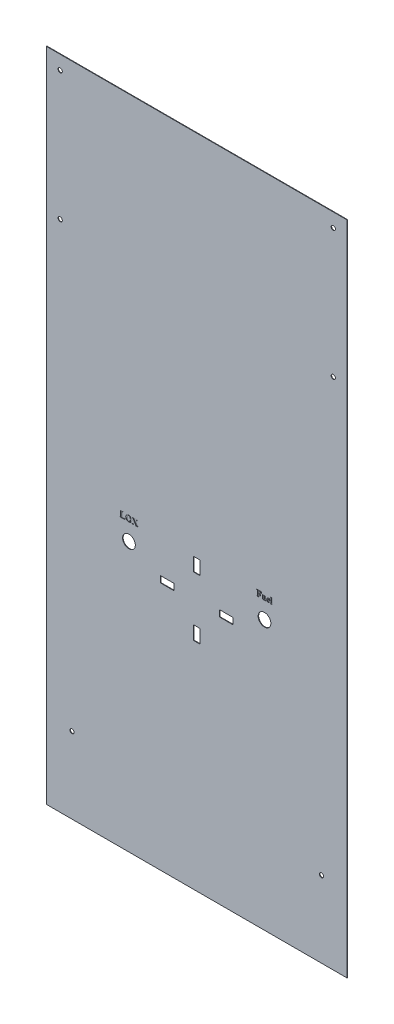
from build123d import *

# Parameters (mm, degrees)
SKETCH1_W           = 901.7
SKETCH1_H           = 1968.5
SKETCH1_R           = 6.35
BOSS_EXTRUDE1_DEPTH = 1.5875
SKETCH2_R           = 19.05
SKETCH2_W           = 19.05
SKETCH2_H           = 40.64
SKETCH2_W_2         = 40.64
SKETCH2_H_2         = 19.05
CUT_EXTRUDE1_DEPTH  = 1083.597018819
WRAP1_START         = -3.81
WRAP1_DEPTH         = 1.27


# Read off the part's stored shape, not the designer's step: Wrap1
with BuildPart() as part:
    # Sketch1 → Boss-Extrude1 (new body)
    with BuildSketch(Plane.XY):
        Rectangle(SKETCH1_W, SKETCH1_H)
        with Locations((-409.447415534, 942.65240495)):
            Circle(SKETCH1_R, mode=Mode.SUBTRACT)
        with Locations((-409.447415534, 555.94759505)):
            Circle(SKETCH1_R, mode=Mode.SUBTRACT)
        with Locations((-374.018387972, -755.65)):
            Circle(SKETCH1_R, mode=Mode.SUBTRACT)
        with Locations(Location((374.018387972, -755.65, 0), (0, 0, 180))):
            Circle(SKETCH1_R, mode=Mode.SUBTRACT)
        with Locations(Location((409.447415534, 555.94759505, 0), (0, 0, 180))):
            Circle(SKETCH1_R, mode=Mode.SUBTRACT)
        with Locations(Location((409.447415534, 942.65240495, 0), (0, 0, 180))):
            Circle(SKETCH1_R, mode=Mode.SUBTRACT)
    extrude(amount=BOSS_EXTRUDE1_DEPTH)

    # Sketch2 → Cut-Extrude1 (cut, through all)
    with BuildSketch(Plane(origin=(0, 0, 0), x_dir=(-1, 0, 0), z_dir=(0, 0, -1))):
        with Locations((203.2, -177.8)):
            Circle(SKETCH2_R)
        with Locations(Location((-203.2, -177.8, 0), (0, 0, 180))):
            Circle(SKETCH2_R)
        with Locations((0, -139.7)):
            Rectangle(SKETCH2_W, SKETCH2_H)
        with Locations((-88.9, -228.6)):
            Rectangle(SKETCH2_W_2, SKETCH2_H_2)
        with Locations((88.9, -228.6)):
            Rectangle(SKETCH2_W_2, SKETCH2_H_2)
        with Locations((0, -317.5)):
            Rectangle(SKETCH2_W, SKETCH2_H)
    extrude(amount=-CUT_EXTRUDE1_DEPTH, mode=Mode.SUBTRACT)

    # Wrap1 outline → Wrap1 (cut)
    # profile 1 of 7: a face of its own
    with BuildSketch(Plane.XY.offset(4.1275).offset(WRAP1_START)):
        with BuildLine():
            add(Edge.make_bspline(
                [(-229.753426043, -126.522165256), (-229.636237529, -126.519976219), (-229.41317649, -126.515809523), (-229.09617467, -126.466288885), (-228.813209456, -126.387863271), (-228.646163395, -126.304456099), (-228.566305351, -126.264582464)],
                knots=[0, 0, 0, 0, 0.286116983, 0.54460586, 0.782294265, 1, 1, 1, 1], degree=3))
            Line((-229.753426043, -126.522165256), (-230.317121718, -126.522165256))
            Line((-230.317121718, -126.522165256), (-230.317121718, -127))
            Line((-230.317121718, -127), (-215.265327284, -127))
            Line((-215.265327284, -127), (-214.548575168, -120.788148329))
            Line((-214.548575168, -120.788148329), (-215.026409912, -120.788148329))
            add(Edge.make_bspline(
                [(-220.151934157, -125.80541314), (-219.932562836, -125.800281899), (-219.510508502, -125.790409766), (-218.907320259, -125.698872442), (-218.358302074, -125.557162613), (-217.864370172, -125.344330626), (-217.414474169, -125.065851051), (-217.002301016, -124.717785385), (-216.620132883, -124.304052356), (-216.331879217, -123.906660058), (-216.11791995, -123.547865792), (-215.951997015, -123.245314942), (-215.794334863, -122.908249637), (-215.632393068, -122.54506771), (-215.481375396, -122.148092083), (-215.322503972, -121.724083219), (-215.171391707, -121.266497406), (-215.07550252, -120.950123175), (-215.026409912, -120.788148329)],
                knots=[0, 0, 0, 0, 0.083692486, 0.161018205, 0.232346257, 0.299586786, 0.365500353, 0.433621102, 0.504882686, 0.580041871, 0.620531465, 0.664319798, 0.71170201, 0.762539634, 0.816086004, 0.873798358, 0.935388254, 1, 1, 1, 1], degree=3))
            Line((-220.151934157, -125.80541314), (-221.585438389, -125.80541314))
            add(Edge.make_bspline(
                [(-223.119735887, -125.693420622), (-223.047852608, -125.711296101), (-222.870193417, -125.755475265), (-222.540067551, -125.779019781), (-222.101040503, -125.803347996), (-221.769696871, -125.804675129), (-221.585438389, -125.80541314)],
                knots=[0, 0, 0, 0, 0.143896066, 0.355638461, 0.641673878, 1, 1, 1, 1], degree=3))
            add(Edge.make_bspline(
                [(-223.866352675, -123.498367267), (-223.865392, -123.601652345), (-223.863551432, -123.799537588), (-223.856493191, -124.080826647), (-223.844815466, -124.333432834), (-223.832218453, -124.555332016), (-223.808811963, -124.748212218), (-223.783249281, -124.91138468), (-223.756011668, -125.047332218), (-223.70606115, -125.185917292), (-223.625445227, -125.332812904), (-223.491822327, -125.481418383), (-223.318626353, -125.601331533), (-223.187975318, -125.661824804), (-223.119735887, -125.693420622)],
                knots=[0, 0, 0, 0, 0.124219593, 0.237993955, 0.338360787, 0.42835088, 0.505199409, 0.571874059, 0.627062731, 0.671557261, 0.748594982, 0.82701569, 0.909649771, 1, 1, 1, 1], degree=3))
            Line((-223.866352675, -123.498367267), (-223.866352675, -112.664957682))
            add(Edge.make_bspline(
                [(-223.739427821, -111.119460932), (-223.749999809, -111.149146381), (-223.773852692, -111.216123714), (-223.798505966, -111.335239557), (-223.821268807, -111.483376173), (-223.833059635, -111.663254918), (-223.849289377, -111.87085995), (-223.861102616, -112.108602576), (-223.862236444, -112.376276017), (-223.864933293, -112.565412846), (-223.866352675, -112.664957682)],
                knots=[0, 0, 0, 0, 0.06067886, 0.136905735, 0.233920776, 0.349449884, 0.48411048, 0.635389887, 0.808101606, 1, 1, 1, 1], degree=3))
            add(Edge.make_bspline(
                [(-223.261593077, -110.533366754), (-223.310259198, -110.565232512), (-223.409867386, -110.630454278), (-223.538040862, -110.765996793), (-223.649286752, -110.930935983), (-223.708665918, -111.055124151), (-223.739427821, -111.119460932)],
                knots=[0, 0, 0, 0, 0.226387342, 0.463362038, 0.721989949, 1, 1, 1, 1], degree=3))
            add(Edge.make_bspline(
                [(-222.160333316, -110.275783963), (-222.268802824, -110.278119635), (-222.476986966, -110.28260246), (-222.772042924, -110.330870623), (-223.035001757, -110.410815629), (-223.188015126, -110.493572376), (-223.261593077, -110.533366754)],
                knots=[0, 0, 0, 0, 0.284002636, 0.54508263, 0.781248603, 1, 1, 1, 1], degree=3))
            Line((-222.160333316, -110.275783963), (-221.477178955, -110.275783963))
            Line((-221.477178955, -110.275783963), (-221.477178955, -109.797949219))
            Line((-221.477178955, -109.797949219), (-230.317121718, -109.797949219))
            Line((-230.317121718, -109.797949219), (-230.317121718, -110.275783963))
            Line((-230.317121718, -110.275783963), (-229.753426043, -110.275783963))
            add(Edge.make_bspline(
                [(-227.927947998, -112.664957682), (-227.929376487, -112.564168786), (-227.932110034, -112.371299754), (-227.933119221, -112.09740266), (-227.945249249, -111.853456485), (-227.960174603, -111.640682081), (-227.976466296, -111.455801376), (-228.004528872, -111.302130434), (-228.026816696, -111.175687487), (-228.073793401, -111.049072991), (-228.148610431, -110.910709437), (-228.275397871, -110.764872143), (-228.434574129, -110.630147904), (-228.626451322, -110.505917808), (-228.855303867, -110.400345023), (-229.122678716, -110.328270983), (-229.42585248, -110.282806886), (-229.64000416, -110.27821564), (-229.753426043, -110.275783963)],
                knots=[0, 0, 0, 0, 0.084622749, 0.161933587, 0.22990784, 0.289599081, 0.34105252, 0.385532842, 0.420773186, 0.448530112, 0.498553263, 0.551922288, 0.609709232, 0.67316662, 0.743282504, 0.820338844, 0.90484545, 1, 1, 1, 1], degree=3))
            Line((-227.927947998, -112.664957682), (-227.927947998, -124.132991536))
            add(Edge.make_bspline(
                [(-228.066072104, -125.678488286), (-228.053878904, -125.648919223), (-228.026103286, -125.581562086), (-228.005452117, -125.460770969), (-227.975507496, -125.313738641), (-227.960396653, -125.134824087), (-227.945152957, -124.925847451), (-227.933270797, -124.688097364), (-227.932024686, -124.420430161), (-227.929359829, -124.232536736), (-227.927947998, -124.132991536)],
                knots=[0, 0, 0, 0, 0.061394352, 0.139853863, 0.234760276, 0.350352995, 0.484827155, 0.638289672, 0.808367287, 1, 1, 1, 1], degree=3))
            add(Edge.make_bspline(
                [(-228.566305351, -126.264582464), (-228.513841635, -126.232933684), (-228.407719614, -126.168915485), (-228.271425976, -126.033307564), (-228.155927585, -125.868003182), (-228.096632758, -125.742944001), (-228.066072104, -125.678488286)],
                knots=[0, 0, 0, 0, 0.23335888, 0.472031298, 0.72788403, 1, 1, 1, 1], degree=3))
        make_face()
    # profile 2 of 7: a face of its own
    with BuildSketch(Plane.XY.offset(4.1275).offset(WRAP1_START)):
        with BuildLine():
            add(Edge.make_bspline(
                [(-194.718433295, -118.260850504), (-194.724017479, -118.527395433), (-194.735035576, -119.053312496), (-194.827203283, -119.829949656), (-194.977372559, -120.582130209), (-195.180608052, -121.312966858), (-195.451068619, -122.017123582), (-195.783231756, -122.69419378), (-196.164460973, -123.35329381), (-196.468850095, -123.762458061), (-196.622306103, -123.968735843)],
                knots=[0, 0, 0, 0, 0.130405832, 0.257302407, 0.382101033, 0.505478704, 0.628069418, 0.750625341, 0.874279213, 1, 1, 1, 1], degree=3))
            add(Edge.make_bspline(
                [(-203.909285948, -109.559031847), (-203.576856146, -109.553848597), (-202.926775912, -109.543712539), (-201.973128758, -109.637324107), (-201.066575694, -109.807149904), (-200.206609472, -110.059482945), (-199.398043873, -110.403407626), (-198.634697098, -110.827047087), (-197.919622082, -111.336565182), (-197.261501448, -111.926383685), (-196.66864867, -112.576115942), (-196.145231314, -113.269846968), (-195.70250353, -114.003776103), (-195.342394477, -114.778877827), (-195.06002235, -115.592766401), (-194.864971074, -116.447883307), (-194.741519452, -117.341405333), (-194.726223502, -117.950592369), (-194.718433295, -118.260850504)],
                knots=[0, 0, 0, 0, 0.069849949, 0.136594465, 0.20103729, 0.263531056, 0.324607527, 0.385387455, 0.446727247, 0.508796852, 0.570828957, 0.631365177, 0.691215795, 0.75067175, 0.810735822, 0.87197288, 0.934795961, 1, 1, 1, 1], degree=3))
            add(Edge.make_bspline(
                [(-212.876153564, -118.272049756), (-212.868157043, -117.961837627), (-212.852455997, -117.352740923), (-212.731856278, -116.457996138), (-212.525783502, -115.604326355), (-212.240446011, -114.788989394), (-211.87789791, -114.011937584), (-211.430577993, -113.276279528), (-210.899609784, -112.582201243), (-210.294740021, -111.934406847), (-209.633428736, -111.3455359), (-208.927659924, -110.831424373), (-208.1808215, -110.409611212), (-207.398487794, -110.06609697), (-206.578639267, -109.807869114), (-205.720070019, -109.63766039), (-204.82597401, -109.543972597), (-204.218086037, -109.553958913), (-203.909285948, -109.559031847)],
                knots=[0, 0, 0, 0, 0.066265956, 0.130112177, 0.192469093, 0.253598737, 0.314376421, 0.375339326, 0.437182314, 0.500765603, 0.564420002, 0.626110784, 0.686953563, 0.747315202, 0.808362113, 0.870201672, 0.934063944, 1, 1, 1, 1], degree=3))
            add(Edge.make_bspline(
                [(-210.882686742, -124.121792285), (-211.041964948, -123.914138898), (-211.358752432, -123.501138302), (-211.765029578, -122.838579483), (-212.106515122, -122.146758921), (-212.387202635, -121.427235156), (-212.608287484, -120.679395853), (-212.764464604, -119.902462731), (-212.860479239, -119.097003096), (-212.870876009, -118.549812049), (-212.876153564, -118.272049756)],
                knots=[0, 0, 0, 0, 0.124469297, 0.247556251, 0.369105337, 0.491161059, 0.614633392, 0.73970266, 0.867869208, 1, 1, 1, 1], degree=3))
            add(Edge.make_bspline(
                [(-203.745030255, -127.238917372), (-203.934245051, -127.237184516), (-204.308079424, -127.233760888), (-204.860990224, -127.193963899), (-205.39821356, -127.136256498), (-205.919316031, -127.05062999), (-206.422649041, -126.9359105), (-206.913431242, -126.809580948), (-207.38332404, -126.64672569), (-207.83756508, -126.462373568), (-208.278052534, -126.25912154), (-208.700899992, -126.027151484), (-209.104515854, -125.767855886), (-209.493225434, -125.487366165), (-209.868142157, -125.18574585), (-210.223166586, -124.854873643), (-210.563395068, -124.500787124), (-210.775787893, -124.248679752), (-210.882686742, -124.121792285)],
                knots=[0, 0, 0, 0, 0.070311969, 0.138916362, 0.205924571, 0.271084613, 0.335043637, 0.397754782, 0.459328336, 0.519703925, 0.579914551, 0.639525377, 0.698797951, 0.758099388, 0.817616847, 0.877506899, 0.938348334, 1, 1, 1, 1], degree=3))
            add(Edge.make_bspline(
                [(-196.622306103, -123.968735843), (-196.728949032, -124.102023109), (-196.940164733, -124.366010264), (-197.283101614, -124.734937967), (-197.635197756, -125.084869872), (-198.011845907, -125.40091671), (-198.399119001, -125.697042327), (-198.803860249, -125.967274303), (-199.225970337, -126.209236136), (-199.663398873, -126.426575744), (-200.117876159, -126.616624885), (-200.586542788, -126.786275217), (-201.075280584, -126.922569372), (-201.578199328, -127.039072591), (-202.097972362, -127.128677976), (-202.632721999, -127.190039728), (-203.183066067, -127.234871185), (-203.555792531, -127.237554845), (-203.745030255, -127.238917372)],
                knots=[0, 0, 0, 0, 0.062892078, 0.124563294, 0.185534769, 0.245726785, 0.305624548, 0.365154215, 0.424941259, 0.484831998, 0.54505371, 0.606415486, 0.668404777, 0.731930775, 0.796623147, 0.862668568, 0.930275174, 1, 1, 1, 1], degree=3))
        make_face()
        with BuildLine():
            add(Edge.make_bspline(
                [(-207.336257002, -112.877743467), (-207.418011601, -113.046803464), (-207.587222221, -113.396713404), (-207.782425416, -113.966883133), (-207.955597854, -114.586083402), (-208.096394776, -115.258230894), (-208.202657758, -115.983986359), (-208.279731821, -116.761310103), (-208.329848235, -117.590726366), (-208.334386685, -118.161225378), (-208.336723497, -118.454970868)],
                knots=[0, 0, 0, 0, 0.098492955, 0.203854633, 0.315738249, 0.435901004, 0.564024753, 0.700575662, 0.845828744, 1, 1, 1, 1], degree=3))
            add(Edge.make_bspline(
                [(-203.759962591, -110.514701335), (-203.950981852, -110.521329236), (-204.32403358, -110.534273219), (-204.864161608, -110.651635695), (-205.370511851, -110.832833113), (-205.839443614, -111.097103002), (-206.275888465, -111.429981496), (-206.669491416, -111.845337128), (-207.030434857, -112.329324537), (-207.232117168, -112.690993562), (-207.336257002, -112.877743467)],
                knots=[0, 0, 0, 0, 0.126292685, 0.246643735, 0.364165419, 0.481050344, 0.601480292, 0.726142767, 0.858592225, 1, 1, 1, 1], degree=3))
            add(Edge.make_bspline(
                [(-199.257863363, -118.555764135), (-199.260150236, -118.28570862), (-199.264577899, -117.762848584), (-199.294598316, -117.004720651), (-199.342354753, -116.298778745), (-199.408046938, -115.644744856), (-199.495249504, -115.0437181), (-199.610124055, -114.49664799), (-199.731670696, -113.999601347), (-199.883973099, -113.55448585), (-200.051568333, -113.153189474), (-200.220491672, -112.780337458), (-200.40937288, -112.442418253), (-200.600277353, -112.129008589), (-200.81201909, -111.85395378), (-201.027892107, -111.603286144), (-201.259982249, -111.387840569), (-201.578216058, -111.139023945), (-202.003960149, -110.884710985), (-202.557457648, -110.672459309), (-203.145997012, -110.53477257), (-203.552612772, -110.521479837), (-203.759962591, -110.514701335)],
                knots=[0, 0, 0, 0, 0.078235768, 0.15147388, 0.219769184, 0.283189358, 0.341871029, 0.39560353, 0.44509179, 0.490008293, 0.531715711, 0.571069594, 0.608500784, 0.643809453, 0.677264075, 0.708938794, 0.739545141, 0.768823346, 0.825888193, 0.882390021, 0.940025916, 1, 1, 1, 1], degree=3))
            add(Edge.make_bspline(
                [(-201.609706243, -125.659822867), (-201.518910442, -125.590370406), (-201.334389107, -125.449224443), (-201.075831196, -125.206206225), (-200.838968032, -124.92773117), (-200.61305054, -124.624253287), (-200.404645933, -124.290370142), (-200.209378265, -123.928329827), (-200.036400501, -123.533280409), (-199.869397069, -123.111498101), (-199.726283579, -122.655643678), (-199.596770806, -122.168011215), (-199.496883696, -121.645799464), (-199.404119426, -121.092516696), (-199.339843069, -120.505377496), (-199.289895411, -119.885502452), (-199.266084208, -119.231633965), (-199.260648465, -118.784738968), (-199.257863363, -118.555764135)],
                knots=[0, 0, 0, 0, 0.044242423, 0.089912429, 0.137048047, 0.185612229, 0.236272384, 0.289296534, 0.344719967, 0.403142498, 0.464849718, 0.529587621, 0.598372434, 0.670607157, 0.746741958, 0.826962138, 0.911340884, 1, 1, 1, 1], degree=3))
            add(Edge.make_bspline(
                [(-203.786094178, -126.283247884), (-203.577534203, -126.277488771), (-203.174112894, -126.266348815), (-202.597987697, -126.140658338), (-202.068139274, -125.953526382), (-201.760935203, -125.756710469), (-201.609706243, -125.659822867)],
                knots=[0, 0, 0, 0, 0.271629072, 0.525416998, 0.766374536, 1, 1, 1, 1], degree=3))
            add(Edge.make_bspline(
                [(-206.794959831, -124.838544401), (-206.703104717, -124.954220234), (-206.52357018, -125.180313328), (-206.21090486, -125.474389772), (-205.875288692, -125.728431585), (-205.505384156, -125.927398468), (-205.115500528, -126.09224697), (-204.695677531, -126.202467996), (-204.250044979, -126.271235548), (-203.943147012, -126.279181566), (-203.786094178, -126.283247884)],
                knots=[0, 0, 0, 0, 0.12750736, 0.249218294, 0.369884192, 0.490218952, 0.611248533, 0.734906211, 0.864340154, 1, 1, 1, 1], degree=3))
            add(Edge.make_bspline(
                [(-208.336723497, -118.454970868), (-208.333476883, -118.803555521), (-208.327195784, -119.477948657), (-208.249358748, -120.453508534), (-208.133703357, -121.359168115), (-207.967016958, -122.194241479), (-207.751395889, -122.960169556), (-207.48801407, -123.655909283), (-207.176706047, -124.284764584), (-206.920066783, -124.657058109), (-206.794959831, -124.838544401)],
                knots=[0, 0, 0, 0, 0.156670188, 0.303103704, 0.439658844, 0.566921389, 0.685563365, 0.796936138, 0.901010077, 1, 1, 1, 1], degree=3))
        make_face(mode=Mode.SUBTRACT)
    # profile 3 of 7: a face of its own
    with BuildSketch(Plane.XY.offset(4.1275).offset(WRAP1_START)):
        with BuildLine():
            add(Edge.make_bspline(
                [(-178.315262477, -123.901540332), (-178.220954099, -124.042332192), (-178.040973638, -124.311022891), (-177.780417607, -124.691101697), (-177.542567801, -125.028886613), (-177.321117656, -125.319631326), (-177.124841845, -125.569878388), (-176.950043375, -125.777286062), (-176.794414717, -125.938631232), (-176.614360473, -126.095060742), (-176.388000485, -126.240639613), (-176.102705495, -126.377493649), (-175.792360898, -126.470692124), (-175.576923504, -126.504766569), (-175.466919433, -126.522165256)],
                knots=[0, 0, 0, 0, 0.126497608, 0.241411193, 0.343994715, 0.434841881, 0.514196246, 0.581398797, 0.637233328, 0.681363404, 0.759169511, 0.837285515, 0.916916671, 1, 1, 1, 1], degree=3))
            Line((-178.315262477, -123.901540332), (-182.847226376, -117.058797476))
            Line((-182.847226376, -117.058797476), (-179.67410503, -113.116660839))
            add(Edge.make_bspline(
                [(-178.035281181, -111.138126352), (-178.067911162, -111.171467294), (-178.144929118, -111.250163361), (-178.270668934, -111.394301992), (-178.43270684, -111.576080202), (-178.621005906, -111.804397521), (-178.841537657, -112.072940804), (-179.091408658, -112.383005643), (-179.372355461, -112.735384894), (-179.569662217, -112.984692027), (-179.67410503, -113.116660839)],
                knots=[0, 0, 0, 0, 0.054447391, 0.128514533, 0.223210912, 0.338706703, 0.473921181, 0.62886415, 0.803542095, 1, 1, 1, 1], degree=3))
            add(Edge.make_bspline(
                [(-175.870092498, -110.275783963), (-175.988388839, -110.28054247), (-176.213111938, -110.289582027), (-176.53193173, -110.325021943), (-176.814061909, -110.385280788), (-177.069543497, -110.463935091), (-177.309766105, -110.576399345), (-177.5452197, -110.730779986), (-177.792284414, -110.916455595), (-177.951864525, -111.062030552), (-178.035281181, -111.138126352)],
                knots=[0, 0, 0, 0, 0.147897503, 0.280955311, 0.400178886, 0.507855505, 0.614267687, 0.73028563, 0.859013314, 1, 1, 1, 1], degree=3))
            Line((-175.870092498, -110.275783963), (-175.870092498, -109.797949219))
            Line((-175.870092498, -109.797949219), (-182.283530702, -109.797949219))
            Line((-182.283530702, -109.797949219), (-182.283530702, -110.275783963))
            add(Edge.make_bspline(
                [(-180.394590229, -111.526367082), (-180.403774393, -111.415123672), (-180.422240277, -111.191455202), (-180.57988662, -110.882221614), (-180.818105816, -110.61362874), (-181.096798512, -110.451322452), (-181.369936212, -110.360529529), (-181.630665232, -110.309534589), (-181.94074642, -110.282292916), (-182.16401731, -110.278053341), (-182.283530702, -110.275783963)],
                knots=[0, 0, 0, 0, 0.130173209, 0.261729146, 0.399541564, 0.547861549, 0.634397953, 0.737427191, 0.859448911, 1, 1, 1, 1], degree=3))
            add(Edge.make_bspline(
                [(-181.77956437, -113.919273885), (-181.670165064, -113.783270081), (-181.462006767, -113.524490375), (-181.183403562, -113.142693233), (-180.942598204, -112.797280643), (-180.746913136, -112.482078866), (-180.592210352, -112.200149806), (-180.481139557, -111.948754979), (-180.412179484, -111.727798585), (-180.400053988, -111.588937844), (-180.394590229, -111.526367082)],
                knots=[0, 0, 0, 0, 0.187080214, 0.355964768, 0.50655841, 0.638342089, 0.753533152, 0.850920003, 0.932824433, 1, 1, 1, 1], degree=3))
            Line((-181.77956437, -113.919273885), (-183.504249149, -116.062064065))
            Line((-183.504249149, -116.062064065), (-185.609708489, -112.885209635))
            Line((-185.609708489, -112.885209635), (-186.479517047, -111.574897173))
            add(Edge.make_bspline(
                [(-186.565377977, -111.093329345), (-186.562378123, -111.181261317), (-186.556756568, -111.34604082), (-186.504082454, -111.502111254), (-186.479517047, -111.574897173)],
                knots=[0, 0, 0, 0, 0.533634166, 1, 1, 1, 1], degree=3))
            add(Edge.make_bspline(
                [(-185.258798599, -110.275783963), (-185.37104042, -110.27798624), (-185.579143812, -110.282069401), (-185.863294114, -110.327280866), (-186.098857514, -110.391690812), (-186.275812465, -110.500759486), (-186.407129066, -110.626867808), (-186.500166643, -110.768269442), (-186.554446759, -110.926544536), (-186.561681095, -111.036923576), (-186.565377977, -111.093329345)],
                knots=[0, 0, 0, 0, 0.193798871, 0.359315288, 0.49675642, 0.612601935, 0.714528736, 0.809401167, 0.902600404, 1, 1, 1, 1], degree=3))
            Line((-185.258798599, -110.275783963), (-184.829493946, -110.275783963))
            Line((-184.829493946, -110.275783963), (-184.829493946, -109.797949219))
            Line((-184.829493946, -109.797949219), (-193.221466637, -109.797949219))
            Line((-193.221466637, -109.797949219), (-193.221466637, -110.275783963))
            add(Edge.make_bspline(
                [(-191.646105215, -111.134393268), (-191.700723502, -111.068399346), (-191.804776639, -110.94267452), (-191.976203892, -110.781825301), (-192.140999932, -110.645457869), (-192.314779915, -110.541253063), (-192.499368964, -110.450303007), (-192.714520602, -110.384128408), (-192.956368151, -110.317695745), (-193.130245394, -110.290205942), (-193.221466637, -110.275783963)],
                knots=[0, 0, 0, 0, 0.138951375, 0.264715855, 0.381158651, 0.485468856, 0.593016643, 0.714420306, 0.850176286, 1, 1, 1, 1], degree=3))
            add(Edge.make_bspline(
                [(-190.425386768, -112.892675802), (-190.510008736, -112.76824351), (-190.66916105, -112.53421814), (-190.893644324, -112.203950584), (-191.090125143, -111.919755069), (-191.2558718, -111.677666631), (-191.393563225, -111.479483765), (-191.504256651, -111.326045529), (-191.583346182, -111.213936229), (-191.628526414, -111.156673246), (-191.646105215, -111.134393268)],
                knots=[0, 0, 0, 0, 0.210884309, 0.396619539, 0.559630646, 0.695069056, 0.807787606, 0.897795021, 0.960233914, 1, 1, 1, 1], degree=3))
            Line((-190.425386768, -112.892675802), (-186.15100566, -119.347177929))
            Line((-186.15100566, -119.347177929), (-189.484649616, -123.487168015))
            add(Edge.make_bspline(
                [(-191.84022558, -125.913672574), (-191.766050175, -125.859885825), (-191.606062475, -125.743874079), (-191.366058271, -125.535878004), (-191.099990605, -125.294138782), (-190.816694507, -125.0094193), (-190.515967961, -124.681894349), (-190.185947113, -124.322032296), (-189.840526286, -123.918365216), (-189.606143705, -123.634376066), (-189.484649616, -123.487168015)],
                knots=[0, 0, 0, 0, 0.081036263, 0.17478577, 0.280771193, 0.39911038, 0.529989712, 0.674191297, 0.831114449, 1, 1, 1, 1], degree=3))
            add(Edge.make_bspline(
                [(-193.605974282, -126.522165256), (-193.428475542, -126.492064393), (-193.090058547, -126.434674445), (-192.617066321, -126.297633403), (-192.196800775, -126.137494655), (-191.955258099, -125.985878432), (-191.84022558, -125.913672574)],
                knots=[0, 0, 0, 0, 0.286640828, 0.546506005, 0.784027577, 1, 1, 1, 1], degree=3))
            Line((-193.605974282, -126.522165256), (-193.605974282, -127))
            Line((-193.605974282, -127), (-186.901355531, -127))
            Line((-186.901355531, -127), (-186.901355531, -126.522165256))
            add(Edge.make_bspline(
                [(-187.983949873, -126.451236661), (-187.92808433, -126.462106428), (-187.794865981, -126.488026741), (-187.557390939, -126.506108324), (-187.252494845, -126.5219491), (-187.025831792, -126.52208863), (-186.901355531, -126.522165256)],
                knots=[0, 0, 0, 0, 0.157013586, 0.374418457, 0.65645018, 1, 1, 1, 1], degree=3))
            add(Edge.make_bspline(
                [(-189.182269817, -125.357443068), (-189.178851806, -125.416422899), (-189.172072093, -125.53341092), (-189.110462365, -125.705148863), (-189.013051414, -125.867543086), (-188.879299513, -126.022595825), (-188.710655866, -126.166853091), (-188.499640293, -126.282553785), (-188.255487944, -126.382385117), (-188.078006956, -126.427387426), (-187.983949873, -126.451236661)],
                knots=[0, 0, 0, 0, 0.100751351, 0.199842915, 0.30878505, 0.423694858, 0.549243335, 0.686728538, 0.833979966, 1, 1, 1, 1], degree=3))
            add(Edge.make_bspline(
                [(-188.010081461, -123.468502596), (-188.103204143, -123.578415982), (-188.279522639, -123.786526001), (-188.514294387, -124.09516081), (-188.716886225, -124.372651741), (-188.880348063, -124.624214005), (-189.016057474, -124.842408939), (-189.104691846, -125.038941749), (-189.167747871, -125.205610863), (-189.177829475, -125.311017685), (-189.182269817, -125.357443068)],
                knots=[0, 0, 0, 0, 0.192150646, 0.363818055, 0.517241748, 0.650310056, 0.764194402, 0.859271298, 0.938017447, 1, 1, 1, 1], degree=3))
            Line((-188.010081461, -123.468502596), (-185.493982887, -120.340178257))
            Line((-185.493982887, -120.340178257), (-183.175737762, -123.841810989))
            add(Edge.make_bspline(
                [(-182.294729953, -125.256649801), (-182.333521799, -125.178930532), (-182.426187099, -124.993276065), (-182.619758612, -124.684435407), (-182.871831428, -124.288855042), (-183.067842083, -124.000524766), (-183.175737762, -123.841810989)],
                knots=[0, 0, 0, 0, 0.156153027, 0.373015693, 0.654871322, 1, 1, 1, 1], degree=3))
            add(Edge.make_bspline(
                [(-182.208869023, -125.663555951), (-182.212308373, -125.590514532), (-182.218918647, -125.450132254), (-182.270153016, -125.319374036), (-182.294729953, -125.256649801)],
                knots=[0, 0, 0, 0, 0.520303695, 1, 1, 1, 1], degree=3))
            add(Edge.make_bspline(
                [(-183.78049736, -126.522165256), (-183.62973452, -126.507746945), (-183.3557518, -126.481544413), (-182.988379234, -126.422634598), (-182.706918014, -126.34236816), (-182.505315768, -126.234799413), (-182.371657244, -126.106352373), (-182.274562777, -125.9723012), (-182.220308703, -125.820433904), (-182.212708266, -125.716205383), (-182.208869023, -125.663555951)],
                knots=[0, 0, 0, 0, 0.22952437, 0.417116787, 0.563269803, 0.671351673, 0.759411843, 0.842075566, 0.920226904, 1, 1, 1, 1], degree=3))
            Line((-183.78049736, -126.522165256), (-183.78049736, -127))
            Line((-183.78049736, -127), (-175.466919433, -127))
            Line((-175.466919433, -127), (-175.466919433, -126.522165256))
        make_face()
    # profile 4 of 7: a face of its own
    with BuildSketch(Plane.XY.offset(4.1275).offset(WRAP1_START)):
        with BuildLine():
            add(Edge.make_bspline(
                [(225.897150336, -124.371908908), (225.89779293, -124.478935376), (225.899018732, -124.683097566), (225.910148184, -124.974412762), (225.928150444, -125.235967251), (225.953767852, -125.466429096), (225.985672624, -125.667875825), (226.030754716, -125.836986712), (226.077542972, -125.978284731), (226.152056385, -126.125592134), (226.286821706, -126.274708238), (226.505716323, -126.402368284), (226.780484112, -126.485826486), (226.982878765, -126.509456044), (227.091737196, -126.522165256)],
                knots=[0, 0, 0, 0, 0.113303814, 0.216136768, 0.308589519, 0.390787078, 0.461608663, 0.524237009, 0.575901825, 0.618914388, 0.6982322, 0.78453931, 0.884113971, 1, 1, 1, 1], degree=3))
            Line((225.897150336, -124.371908908), (225.897150336, -109.797949219))
            Line((225.897150336, -109.797949219), (221.118802897, -109.797949219))
            Line((221.118802897, -109.797949219), (221.118802897, -110.275783963))
            add(Edge.make_bspline(
                [(222.313389757, -112.42604031), (222.312711865, -112.319019474), (222.311418729, -112.114868025), (222.300788763, -111.824721152), (222.281474139, -111.564634085), (222.258992353, -111.33456812), (222.218104833, -111.135078672), (222.18235245, -110.963141627), (222.128237881, -110.824214327), (222.055408195, -110.675778042), (221.91875454, -110.527441679), (221.703421231, -110.395520993), (221.428802406, -110.3118181), (221.227634815, -110.288434512), (221.118802897, -110.275783963)],
                knots=[0, 0, 0, 0, 0.113475465, 0.216464207, 0.307741029, 0.390063115, 0.461224767, 0.523628009, 0.575823302, 0.618901027, 0.698339003, 0.785468901, 0.883938407, 1, 1, 1, 1], degree=3))
            Line((222.313389757, -112.42604031), (222.313389757, -124.371908908))
            add(Edge.make_bspline(
                [(222.100603973, -126.03313126), (222.117659052, -126.002426672), (222.156537167, -125.93243365), (222.199031444, -125.803696314), (222.235040733, -125.643622125), (222.264353755, -125.451474495), (222.286208578, -125.227171483), (222.299234716, -124.970542076), (222.311920293, -124.681873132), (222.31288234, -124.478941952), (222.313389757, -124.371908908)],
                knots=[0, 0, 0, 0, 0.062274042, 0.141957556, 0.239524505, 0.353613935, 0.486876676, 0.639624286, 0.809925169, 1, 1, 1, 1], degree=3))
            add(Edge.make_bspline(
                [(221.118802897, -126.522165256), (221.222937791, -126.512967248), (221.420694176, -126.495499859), (221.694726847, -126.399501839), (221.929352913, -126.247804202), (222.043116973, -126.105194483), (222.100603973, -126.03313126)],
                knots=[0, 0, 0, 0, 0.274716901, 0.521698533, 0.75830578, 1, 1, 1, 1], degree=3))
            Line((221.118802897, -126.522165256), (221.118802897, -127))
            Line((221.118802897, -127), (227.091737196, -127))
            Line((227.091737196, -127), (227.091737196, -126.522165256))
        make_face()
    # profile 5 of 7: a face of its own
    with BuildSketch(Plane.XY.offset(4.1275).offset(WRAP1_START)):
        with BuildLine():
            add(Edge.make_bspline(
                [(213.473446994, -120.788148329), (213.484435832, -120.960148917), (213.505943609, -121.29679511), (213.583114555, -121.786676721), (213.684978238, -122.249040656), (213.821703415, -122.682893581), (213.983799397, -123.090003948), (214.180318154, -123.468878969), (214.401634918, -123.824018593), (214.579570657, -124.035377647), (214.668033854, -124.140457704)],
                knots=[0, 0, 0, 0, 0.142498601, 0.278903765, 0.409754711, 0.533792625, 0.654786412, 0.771718901, 0.886506916, 1, 1, 1, 1], degree=3))
            Line((213.473446994, -120.788148329), (219.685298665, -120.788148329))
            add(Edge.make_bspline(
                [(215.186932521, -115.054131402), (215.332744169, -115.058510463), (215.622200037, -115.067203493), (216.048806762, -115.134412784), (216.458018259, -115.253112742), (216.855015559, -115.409736193), (217.234216931, -115.616447449), (217.601105015, -115.865873655), (217.951321342, -116.161091595), (218.283547274, -116.50245011), (218.594544826, -116.883472124), (218.86336233, -117.315423435), (219.099552053, -117.785633618), (219.293677172, -118.302842174), (219.448696858, -118.86284987), (219.567373822, -119.466872314), (219.649949143, -120.112981811), (219.673298611, -120.558950461), (219.685298665, -120.788148329)],
                knots=[0, 0, 0, 0, 0.053851778, 0.106903072, 0.158993774, 0.210976872, 0.264244788, 0.318174982, 0.374616845, 0.433126587, 0.493931417, 0.555909881, 0.620664302, 0.688022464, 0.759624451, 0.835078572, 0.915241487, 1, 1, 1, 1], degree=3))
            add(Edge.make_bspline(
                [(209.889686415, -121.336911668), (209.894719185, -121.10276357), (209.90454369, -120.645681529), (209.980594115, -119.978999285), (210.102613191, -119.349353239), (210.2741664, -118.754968824), (210.497535894, -118.198065108), (210.772958134, -117.678469985), (211.094379424, -117.194692575), (211.463511022, -116.751469289), (211.868601015, -116.356868909), (212.289861517, -116.006538666), (212.730381362, -115.712693562), (213.188089446, -115.471799928), (213.664038535, -115.28490749), (214.156563033, -115.148604378), (214.666675717, -115.069113443), (215.012450108, -115.059156041), (215.186932521, -115.054131402)],
                knots=[0, 0, 0, 0, 0.076562623, 0.149458401, 0.21913521, 0.286105541, 0.351475226, 0.415010164, 0.478105644, 0.541102612, 0.603263254, 0.662822278, 0.720048412, 0.77611527, 0.831661283, 0.886950275, 0.942953587, 1, 1, 1, 1], degree=3))
            add(Edge.make_bspline(
                [(210.968547673, -125.271582137), (210.88102663, -125.137625359), (210.705153318, -124.868439554), (210.492613936, -124.431055744), (210.303414385, -123.974618269), (210.150153402, -123.492736846), (210.037104595, -122.986250765), (209.948583271, -122.458223958), (209.902174638, -121.905168811), (209.893899387, -121.528616399), (209.889686415, -121.336911668)],
                knots=[0, 0, 0, 0, 0.115803047, 0.23270593, 0.351552617, 0.473563527, 0.598418097, 0.72719374, 0.861112958, 1, 1, 1, 1], degree=3))
            add(Edge.make_bspline(
                [(214.914417394, -127.238917372), (214.703729756, -127.233864665), (214.292610381, -127.224005208), (213.696785522, -127.127513253), (213.13887858, -126.977069211), (212.622985722, -126.757196627), (212.145015008, -126.480466919), (211.707965539, -126.139364108), (211.30691038, -125.738898373), (211.082697561, -125.429235729), (210.968547673, -125.271582137)],
                knots=[0, 0, 0, 0, 0.137204424, 0.267729979, 0.392271254, 0.512917972, 0.632116942, 0.751180664, 0.873322589, 1, 1, 1, 1], degree=3))
            add(Edge.make_bspline(
                [(219.685298665, -123.416239421), (219.605780294, -123.584895446), (219.451712401, -123.911668717), (219.204794229, -124.376907407), (218.950341491, -124.801946302), (218.694303997, -125.193874332), (218.424581023, -125.543359165), (218.15255458, -125.859695507), (217.873300421, -126.136028928), (217.586567255, -126.375587228), (217.288999838, -126.576118976), (216.984868778, -126.755089568), (216.667742744, -126.902249872), (216.340858213, -127.028855322), (216.000030954, -127.120331824), (215.648204292, -127.18765311), (215.285001608, -127.229779755), (215.038965215, -127.235846355), (214.914417394, -127.238917372)],
                knots=[0, 0, 0, 0, 0.085828138, 0.166293149, 0.242330062, 0.313823047, 0.381648941, 0.445397375, 0.505750891, 0.562298265, 0.617113102, 0.670757122, 0.724569091, 0.777869471, 0.831927831, 0.886751647, 0.942671751, 1, 1, 1, 1], degree=3))
            Line((219.685298665, -123.416239421), (219.255994013, -123.177322049))
            add(Edge.make_bspline(
                [(216.672699928, -125.088661024), (216.791421251, -125.083974405), (217.025324331, -125.074740892), (217.365670203, -124.991010226), (217.691516567, -124.865737813), (218.002764023, -124.673953047), (218.310747805, -124.415701638), (218.624350768, -124.079404838), (218.942669548, -123.658350097), (219.14729079, -123.344207513), (219.255994013, -123.177322049)],
                knots=[0, 0, 0, 0, 0.105424729, 0.207706318, 0.31005375, 0.414825833, 0.531164543, 0.666607217, 0.822888038, 1, 1, 1, 1], degree=3))
            add(Edge.make_bspline(
                [(214.668033854, -124.140457704), (214.737224099, -124.216910611), (214.87225015, -124.36610988), (215.100832508, -124.556095409), (215.334102487, -124.723587943), (215.583593361, -124.852302243), (215.839535799, -124.960699447), (216.10831747, -125.033406274), (216.387327271, -125.080545548), (216.576688627, -125.085930639), (216.672699928, -125.088661024)],
                knots=[0, 0, 0, 0, 0.134919963, 0.263298817, 0.388576173, 0.510368139, 0.630257589, 0.752082285, 0.87429905, 1, 1, 1, 1], degree=3))
        make_face()
        with BuildLine():
            add(Edge.make_bspline(
                [(215.758094364, -116.21885359), (215.715890545, -116.185464945), (215.631040376, -116.118337554), (215.474479544, -116.057257161), (215.302645961, -116.013317442), (215.179795928, -116.011002805), (215.116003927, -116.00980089)],
                knots=[0, 0, 0, 0, 0.232672174, 0.467784049, 0.723637675, 1, 1, 1, 1], degree=3))
            add(Edge.make_bspline(
                [(216.57937283, -119.832478841), (216.57815544, -119.683164175), (216.575821963, -119.396959862), (216.572034655, -118.984794933), (216.54875463, -118.609325407), (216.535561247, -118.270170354), (216.502716886, -117.96930557), (216.470920622, -117.703778395), (216.432081819, -117.47387069), (216.367082665, -117.223662081), (216.275295191, -116.951215735), (216.135391836, -116.663950962), (215.965533996, -116.416189083), (215.826465873, -116.283894804), (215.758094364, -116.21885359)],
                knots=[0, 0, 0, 0, 0.117461895, 0.225149355, 0.32413075, 0.413337278, 0.492033041, 0.562085029, 0.623719301, 0.675235114, 0.765312701, 0.849359813, 0.925939196, 1, 1, 1, 1], degree=3))
            Line((216.57937283, -119.832478841), (213.473446994, -119.832478841))
            Line((213.473446994, -119.832478841), (213.473446994, -119.425572692))
            add(Edge.make_bspline(
                [(214.145402103, -116.599628152), (214.091434461, -116.688287968), (213.980986667, -116.869735237), (213.844736112, -117.165381535), (213.728537195, -117.483751515), (213.636225129, -117.826357975), (213.561311693, -118.19146538), (213.509581338, -118.581886146), (213.480528455, -118.995820581), (213.475846785, -119.279936775), (213.473446994, -119.425572692)],
                knots=[0, 0, 0, 0, 0.105683126, 0.216286423, 0.330999153, 0.450650361, 0.577463014, 0.710511166, 0.851610106, 1, 1, 1, 1], degree=3))
            add(Edge.make_bspline(
                [(215.116003927, -116.00980089), (215.020260492, -116.016772573), (214.83218273, -116.030467701), (214.565365604, -116.148259392), (214.329499766, -116.339846718), (214.208686654, -116.510326903), (214.145402103, -116.599628152)],
                knots=[0, 0, 0, 0, 0.241168632, 0.473750048, 0.724338765, 1, 1, 1, 1], degree=3))
        make_face(mode=Mode.SUBTRACT)
    # profile 6 of 7: a face of its own
    with BuildSketch(Plane.XY.offset(4.1275).offset(WRAP1_START)):
        with BuildLine():
            add(Edge.make_bspline(
                [(206.783760579, -124.371908908), (206.784395331, -124.481422313), (206.785600291, -124.689313397), (206.796716774, -124.98562686), (206.814858649, -125.249598645), (206.839487333, -125.481578661), (206.874699328, -125.680382411), (206.908140845, -125.849243391), (206.956107465, -125.984974566), (207.031210314, -126.124276012), (207.170474694, -126.25992339), (207.387587762, -126.383262682), (207.662881164, -126.474804773), (207.868148551, -126.505621261), (207.978347439, -126.522165256)],
                knots=[0, 0, 0, 0, 0.116020453, 0.220243522, 0.314076703, 0.396332412, 0.467204098, 0.527976068, 0.578435535, 0.619154622, 0.694668533, 0.780359926, 0.882085058, 1, 1, 1, 1], degree=3))
            Line((206.783760579, -124.371908908), (206.783760579, -115.293048774))
            Line((206.783760579, -115.293048774), (202.00541314, -115.293048774))
            Line((202.00541314, -115.293048774), (202.00541314, -115.770883518))
            add(Edge.make_bspline(
                [(203.2, -117.921139865), (203.199305079, -117.81163153), (203.197985899, -117.603750069), (203.187677488, -117.308613101), (203.167253485, -117.046210669), (203.148921221, -116.816286749), (203.113921953, -116.618234257), (203.074152161, -116.453668371), (203.031530681, -116.31754321), (202.956042568, -116.181060606), (202.820065788, -116.043443893), (202.60464931, -115.916301083), (202.325177344, -115.826497773), (202.117978104, -115.790461121), (202.00541314, -115.770883518)],
                knots=[0, 0, 0, 0, 0.116169972, 0.220527356, 0.313164742, 0.395388824, 0.465050798, 0.526201019, 0.575042058, 0.615813621, 0.690509018, 0.77698849, 0.878844718, 1, 1, 1, 1], degree=3))
            Line((203.2, -117.921139865), (203.2, -124.237517887))
            add(Edge.make_bspline(
                [(202.091274071, -125.566495768), (202.174168154, -125.500185334), (202.359746653, -125.351733352), (202.618448108, -125.051194896), (202.912171947, -124.679578898), (203.099173586, -124.392372239), (203.2, -124.237517887)],
                knots=[0, 0, 0, 0, 0.182785657, 0.409210003, 0.681461416, 1, 1, 1, 1], degree=3))
            add(Edge.make_bspline(
                [(201.337191115, -125.80541314), (201.405906056, -125.802690298), (201.541119666, -125.797332435), (201.737527339, -125.750398248), (201.923789255, -125.676431443), (202.035123548, -125.603352516), (202.091274071, -125.566495768)],
                knots=[0, 0, 0, 0, 0.256146427, 0.504031335, 0.749862335, 1, 1, 1, 1], degree=3))
            add(Edge.make_bspline(
                [(200.332991536, -123.416239421), (200.334563848, -123.609112963), (200.33740506, -123.957641112), (200.353207655, -124.423695093), (200.383795475, -124.777918677), (200.428600591, -125.03642746), (200.501057154, -125.224236772), (200.575624313, -125.379730475), (200.676959184, -125.506762863), (200.817296813, -125.652791125), (201.041677323, -125.776861321), (201.238560088, -125.795883652), (201.337191115, -125.80541314)],
                knots=[0, 0, 0, 0, 0.199348445, 0.360228488, 0.481666427, 0.566912627, 0.629979681, 0.689220041, 0.744263756, 0.797005927, 0.898307431, 1, 1, 1, 1], degree=3))
            Line((200.332991536, -123.416239421), (200.332991536, -115.293048774))
            Line((200.332991536, -115.293048774), (195.554644097, -115.293048774))
            Line((195.554644097, -115.293048774), (195.554644097, -115.770883518))
            add(Edge.make_bspline(
                [(196.749230957, -117.921139865), (196.748536036, -117.81163153), (196.747216856, -117.603750069), (196.736908445, -117.308613101), (196.716484442, -117.046210669), (196.698152178, -116.816286749), (196.66315291, -116.618234257), (196.623383118, -116.453668371), (196.580761638, -116.31754321), (196.505273525, -116.181060606), (196.369296745, -116.043443893), (196.153880267, -115.916301083), (195.874408301, -115.826497773), (195.667209061, -115.790461121), (195.554644097, -115.770883518)],
                knots=[0, 0, 0, 0, 0.116169972, 0.220527356, 0.313164742, 0.395388824, 0.465050798, 0.526201019, 0.575042058, 0.615813621, 0.690509018, 0.77698849, 0.878844718, 1, 1, 1, 1], degree=3))
            Line((196.749230957, -117.921139865), (196.749230957, -122.468036101))
            add(Edge.make_bspline(
                [(199.731965023, -127.238917372), (199.574450382, -127.232085326), (199.263998307, -127.218619767), (198.814905916, -127.101348143), (198.390881884, -126.916256375), (198.006341292, -126.655549568), (197.666138045, -126.347710182), (197.377250195, -126.010835987), (197.15593907, -125.644107303), (197.016184065, -125.315925275), (196.937954288, -125.024561219), (196.886111458, -124.769069793), (196.847860462, -124.474366357), (196.808296033, -124.144937171), (196.785905934, -123.777205499), (196.760707047, -123.374239053), (196.75161589, -122.933464828), (196.750047115, -122.627312512), (196.749230957, -122.468036101)],
                knots=[0, 0, 0, 0, 0.073706266, 0.145270708, 0.216025163, 0.289613689, 0.36186854, 0.430559966, 0.496765889, 0.561852933, 0.59693819, 0.637994494, 0.683929235, 0.73615498, 0.793447977, 0.856523856, 0.925356223, 1, 1, 1, 1], degree=3))
            add(Edge.make_bspline(
                [(203.2, -125.424638579), (203.06595107, -125.582794182), (202.810615825, -125.884047611), (202.399047994, -126.276474217), (201.990476897, -126.598034205), (201.571338387, -126.842790192), (201.140440278, -127.019702058), (200.692647179, -127.148548154), (200.219779811, -127.223449933), (199.896481662, -127.233700943), (199.731965023, -127.238917372)],
                knots=[0, 0, 0, 0, 0.152850907, 0.29114909, 0.418761231, 0.535586322, 0.647932721, 0.761543386, 0.878656649, 1, 1, 1, 1], degree=3))
            Line((203.2, -125.424638579), (203.2, -127))
            Line((203.2, -127), (207.978347439, -127))
            Line((207.978347439, -127), (207.978347439, -126.522165256))
        make_face()
    # profile 7 of 7: a face of its own
    with BuildSketch(Plane.XY.offset(4.1275).offset(WRAP1_START)):
        with BuildLine():
            add(Edge.make_bspline(
                [(186.475783963, -117.682222493), (186.650254704, -117.678657999), (186.983378702, -117.671852165), (187.458634767, -117.600656413), (187.883080829, -117.482524367), (188.264204856, -117.316630361), (188.605632982, -117.088620321), (188.915513057, -116.799955045), (189.193835836, -116.443673836), (189.449285584, -116.02720192), (189.670166659, -115.536315637), (189.847791253, -114.967537753), (189.979776588, -114.320544081), (190.032113919, -113.861314768), (190.059544542, -113.62062717)],
                knots=[0, 0, 0, 0, 0.085711886, 0.163653148, 0.23548944, 0.301755796, 0.367069612, 0.436320393, 0.5090161, 0.588638511, 0.675961237, 0.772877052, 0.880962136, 1, 1, 1, 1], degree=3))
            Line((186.475783963, -117.682222493), (185.997949219, -117.682222493))
            Line((185.997949219, -117.682222493), (185.997949219, -110.992536079))
            Line((185.997949219, -110.992536079), (187.670370822, -110.992536079))
            add(Edge.make_bspline(
                [(190.43658602, -111.186656443), (190.368281418, -111.171058377), (190.218790583, -111.136920589), (189.972068262, -111.096888096), (189.685530122, -111.064061546), (189.359165129, -111.039453606), (188.993377978, -111.016141724), (188.587566261, -111.001990915), (188.142005799, -110.995475393), (187.832139682, -110.993544251), (187.670370822, -110.992536079)],
                knots=[0, 0, 0, 0, 0.075634617, 0.16553324, 0.269692222, 0.386960346, 0.518876508, 0.665423944, 0.825331057, 1, 1, 1, 1], degree=3))
            add(Edge.make_bspline(
                [(193.40438775, -115.054131402), (193.388669256, -114.909552949), (193.358198612, -114.629284456), (193.286034461, -114.225855791), (193.200287, -113.850786298), (193.101337579, -113.503124264), (192.982314378, -113.184329689), (192.843771932, -112.896354522), (192.690404248, -112.63537032), (192.460945963, -112.326316933), (192.118111565, -111.987343003), (191.631933844, -111.64807411), (191.065766681, -111.37309847), (190.651535582, -111.250351395), (190.43658602, -111.186656443)],
                knots=[0, 0, 0, 0, 0.082619373, 0.160159463, 0.232716128, 0.301192205, 0.365414291, 0.425821071, 0.482574762, 0.537163982, 0.644163675, 0.754806929, 0.872766329, 1, 1, 1, 1], degree=3))
            Line((193.40438775, -115.054131402), (193.882222493, -115.054131402))
            Line((193.882222493, -115.054131402), (193.882222493, -109.797949219))
            Line((193.882222493, -109.797949219), (179.547180176, -109.797949219))
            Line((179.547180176, -109.797949219), (179.547180176, -110.275783963))
            Line((179.547180176, -110.275783963), (180.11087585, -110.275783963))
            add(Edge.make_bspline(
                [(181.936353895, -112.664957682), (181.934925407, -112.564168786), (181.93219186, -112.371299754), (181.931182672, -112.09740266), (181.919052644, -111.853456485), (181.90412729, -111.640682081), (181.887835597, -111.455801376), (181.859773021, -111.302130434), (181.837485198, -111.175687487), (181.790508492, -111.049072991), (181.715691462, -110.910709437), (181.588904023, -110.764872143), (181.429727764, -110.630147904), (181.237850572, -110.505917808), (181.008998027, -110.400345023), (180.741623178, -110.328270983), (180.438449413, -110.282806886), (180.224297734, -110.27821564), (180.11087585, -110.275783963)],
                knots=[0, 0, 0, 0, 0.084622749, 0.161933587, 0.22990784, 0.289599081, 0.34105252, 0.385532842, 0.420773186, 0.448530112, 0.498553263, 0.551922288, 0.609709232, 0.67316662, 0.743282504, 0.820338844, 0.90484545, 1, 1, 1, 1], degree=3))
            Line((181.936353895, -112.664957682), (181.936353895, -124.132991536))
            add(Edge.make_bspline(
                [(181.79822979, -125.678488286), (181.810422989, -125.648919223), (181.838198607, -125.581562086), (181.858849777, -125.460770969), (181.888794398, -125.313738641), (181.90390524, -125.134824087), (181.919148937, -124.925847451), (181.931031096, -124.688097364), (181.932277208, -124.420430161), (181.934942065, -124.232536736), (181.936353895, -124.132991536)],
                knots=[0, 0, 0, 0, 0.061394352, 0.139853863, 0.234760276, 0.350352995, 0.484827155, 0.638289672, 0.808367287, 1, 1, 1, 1], degree=3))
            add(Edge.make_bspline(
                [(181.297996542, -126.264582464), (181.350460258, -126.232933684), (181.45658228, -126.168915485), (181.592875917, -126.033307564), (181.708374309, -125.868003182), (181.767669135, -125.742944001), (181.79822979, -125.678488286)],
                knots=[0, 0, 0, 0, 0.23335888, 0.472031298, 0.72788403, 1, 1, 1, 1], degree=3))
            add(Edge.make_bspline(
                [(180.11087585, -126.522165256), (180.228064364, -126.519976219), (180.451125404, -126.515809523), (180.768127224, -126.466288885), (181.051092438, -126.387863271), (181.218138498, -126.304456099), (181.297996542, -126.264582464)],
                knots=[0, 0, 0, 0, 0.286116983, 0.54460586, 0.782294265, 1, 1, 1, 1], degree=3))
            Line((180.11087585, -126.522165256), (179.547180176, -126.522165256))
            Line((179.547180176, -126.522165256), (179.547180176, -127))
            Line((179.547180176, -127), (188.387122938, -127))
            Line((188.387122938, -127), (188.387122938, -126.522165256))
            Line((188.387122938, -126.522165256), (187.827160348, -126.522165256))
            add(Edge.make_bspline(
                [(185.997949219, -124.132991536), (185.999330929, -124.233783521), (186.001974961, -124.426658462), (186.003586657, -124.700515783), (186.013813147, -124.944685779), (186.034724513, -125.158403437), (186.05135834, -125.342943017), (186.072870612, -125.499146706), (186.101199072, -125.624263743), (186.146086721, -125.752741804), (186.228378689, -125.886523845), (186.352266748, -126.033399562), (186.512224763, -126.16770258), (186.703861907, -126.292062019), (186.932788743, -126.397594764), (187.200140996, -126.469681024), (187.502087819, -126.514957115), (187.714986955, -126.519677929), (187.827160348, -126.522165256)],
                knots=[0, 0, 0, 0, 0.084644958, 0.161976087, 0.22996818, 0.289757321, 0.342263894, 0.385561923, 0.422059405, 0.449823616, 0.499465557, 0.552848589, 0.610650699, 0.674124743, 0.744259029, 0.821335592, 0.905864377, 1, 1, 1, 1], degree=3))
            Line((185.997949219, -124.132991536), (185.997949219, -118.876809353))
            Line((185.997949219, -118.876809353), (186.475783963, -118.876809353))
            add(Edge.make_bspline(
                [(190.059544542, -122.938404677), (190.037957965, -122.740287674), (189.996536177, -122.36012735), (189.904253018, -121.817315077), (189.785867218, -121.32664532), (189.642723857, -120.888191983), (189.470140639, -120.504579665), (189.276995558, -120.171478162), (189.056257262, -119.891342195), (188.730415244, -119.594933491), (188.284177245, -119.30946338), (187.712335587, -119.058445635), (187.104888513, -118.902962274), (186.686982658, -118.885589234), (186.475783963, -118.876809353)],
                knots=[0, 0, 0, 0, 0.098084059, 0.188210336, 0.270810163, 0.346351921, 0.414888851, 0.477498182, 0.535468244, 0.589651445, 0.693623523, 0.794563541, 0.896177784, 1, 1, 1, 1], degree=3))
            Line((190.059544542, -122.938404677), (190.537379286, -122.938404677))
            Line((190.537379286, -122.938404677), (190.537379286, -113.62062717))
            Line((190.537379286, -113.62062717), (190.059544542, -113.62062717))
        make_face()
    extrude(amount=WRAP1_DEPTH, mode=Mode.SUBTRACT)


solid = part.part
